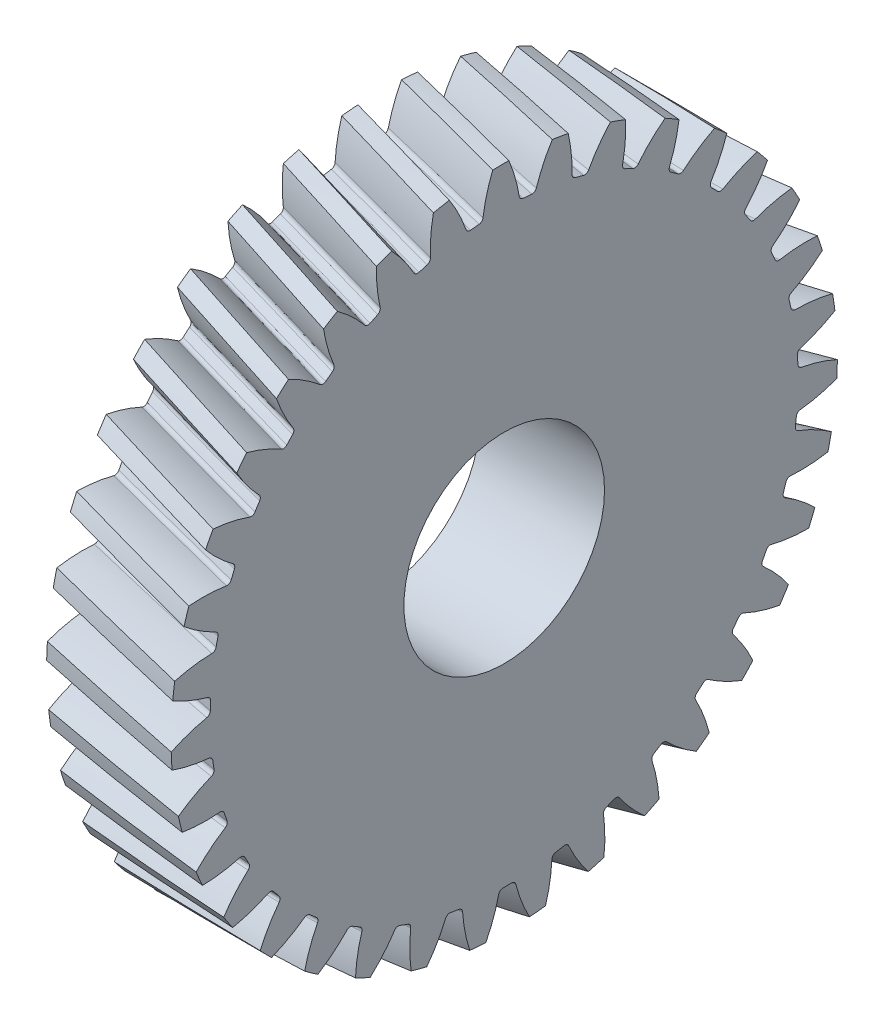
from build123d import *

# Parameters (mm, degrees)
BASPROSKE_W            = 25
BASPROSKE_H            = 66.91066605
TOOTHCUTRH_PITCH       = 1568.999368893
TOOTHCUTRH_HEIGHT      = 25
TOOTHCUTRH_RADIUS      = 66.91066605
TOOTHCUTRH_START_ANGLE = -90
TEETHCUTSRH_COUNT      = 35
TEETHCUTSRH_ANGLE      = 349.714285714
BORSKE_R               = 20
BORE_DEPTH             = 62.5000025
SKETCH3_R              = 20.15
CUT_EXTRUDE1_DEPTH     = 98.872746433


with BuildPart() as part:
    # BasProSke → Base-Revolve (revolve)
    with BuildSketch(Plane(origin=(0, 0, 0), x_dir=(1, 0, 0), z_dir=(0, 1, 0)), mode=Mode.PRIVATE) as base_revolve_sk:
        with Locations((12.5, 33.455333025)):
            Rectangle(BASPROSKE_W, BASPROSKE_H)
    revolve(base_revolve_sk.sketch.rotate(Axis((-10, 0, 0), (1, 0, 0)), 180), axis=Axis((-10, 0, 0), (1, 0, 0)))

    # ToothCutRH: sweep along a helix
    with BuildLine() as toothcutrh_path:
        add(Helix(TOOTHCUTRH_PITCH, TOOTHCUTRH_HEIGHT, TOOTHCUTRH_RADIUS, center=(0, 0, 0), direction=(1, 0, 0), mode=Mode.PRIVATE).rotate(Axis((0, 0, 0), (1, 0, 0)), TOOTHCUTRH_START_ANGLE))
    # TooCutSkeRH → ToothCutRH (sweep, cut)
    with BuildSketch(Plane(origin=(0, 0, 0), x_dir=(0, 0, -1), z_dir=(1, 0, 0))):
        with BuildLine():
            ThreePointArc((0.85755594, 59.029437265), (0, 59.03566605), (-0.85755594, 59.029437265))
            ThreePointArc((-0.85755594, 59.029437265), (-1.407406131, 59.213338806), (-1.721964393, 59.700378958))
            ThreePointArc((-1.721964393, 59.700378958), (-3.243096497, 64.350655298), (-5.48538353, 68.699340362))
            ThreePointArc((-5.48538353, 68.699340362), (0, 68.917986032), (5.48538353, 68.699340362))
            ThreePointArc((5.48538353, 68.699340362), (3.243096497, 64.350655298), (1.721964393, 59.700378958))
            ThreePointArc((1.721964393, 59.700378958), (1.407406131, 59.213338806), (0.85755594, 59.029437265))
        make_face()
    toothcutrh = sweep(path=toothcutrh_path.line, is_frenet=True, mode=Mode.SUBTRACT)

    # TeethCutsRH: ToothCutRH ×35 about axis
    teethcutsrh_axis = Axis((-10, 0, 0), (1, 0, 0))
    for i in range(1, TEETHCUTSRH_COUNT):
        add(toothcutrh.rotate(teethcutsrh_axis, i * TEETHCUTSRH_ANGLE / (TEETHCUTSRH_COUNT - 1)), mode=Mode.SUBTRACT)

    # BorSke → Bore (cut, symmetric)
    with BuildSketch(Plane(origin=(0, 0, 0), x_dir=(0, 0, -1), z_dir=(1, 0, 0))):
        with Locations(Location((0, 0, 0), (0, 0, 180))):
            Circle(BORSKE_R)
    extrude(amount=BORE_DEPTH, both=True, mode=Mode.SUBTRACT)

    # Sketch3 → Cut-Extrude1 (cut, through all)
    with BuildSketch(Plane(origin=(25, 0, 0), x_dir=(0, 0, -1), z_dir=(1, 0, 0))):
        Circle(SKETCH3_R)
    extrude(amount=-CUT_EXTRUDE1_DEPTH, mode=Mode.SUBTRACT)


solid = part.part
